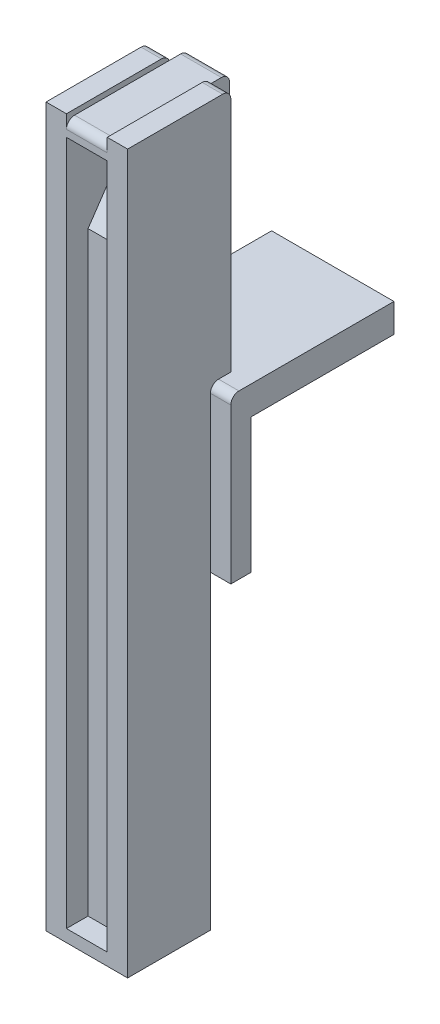
from build123d import *

# Parameters (mm, degrees)
BOSS_EXTRUDE2_DEPTH = 15
BOSS_EXTRUDE3_DEPTH = 5
BOSS_EXTRUDE4_DEPTH = 5
BOSS_EXTRUDE5_DEPTH = 10
SKETCH10_W          = 10
SKETCH10_H          = 3
BOSS_EXTRUDE6_DEPTH = 5.3
FILLET1_R           = 2
FILLET2_R           = 2


with BuildPart() as part:
    # Sketch2 → Boss-Extrude2 (new, symmetric)
    with BuildSketch(Plane(origin=(0, 0, 0), x_dir=(0, 0, -1), z_dir=(1, 0, 0))):
        Polygon((0, 0), (0, -40), (5, -40), (5, -7), (40, -7), (40, 0), align=None)
    extrude(amount=BOSS_EXTRUDE2_DEPTH, both=True)

    # Sketch3 → Boss-Extrude3 (add, symmetric)
    with BuildSketch(Plane(origin=(0, 0, 0), x_dir=(0, 0, -1), z_dir=(1, 0, 0))):
        Polygon((0, -116), (-15, -116), (-15, 32.97157442), (0, 55.00157442), align=None)
    extrude(amount=BOSS_EXTRUDE3_DEPTH, both=True)

    # Sketch4 → Boss-Extrude4 (add)
    with BuildSketch(Plane.ZY.offset(5)):
        Polygon((0, 60), (20.3, 60), (20.3, -116), (0, -116), (0, 0), (-5, 0), (-5, 60), align=None)
    boss_extrude4 = extrude(amount=BOSS_EXTRUDE4_DEPTH)

    # Mirror1: Boss-Extrude4 across plane
    add(boss_extrude4.mirror(Plane(origin=(0, 0, 0), x_dir=(0, 0, 1), z_dir=(1, 0, 0))))

    # Sketch8 → Boss-Extrude5 (add)
    with BuildSketch(Plane.ZY.offset(-5)):
        Polygon((0, 0), (0, 55), (20.3, 55), (20.3, 58.7), (-9.7, 58.7), (-9.7, 0), align=None)
    extrude(amount=BOSS_EXTRUDE5_DEPTH)

    # Sketch10 → Boss-Extrude6 (add)
    with BuildSketch(Plane.XY.offset(15)):
        with Locations((0, -114.5)):
            Rectangle(SKETCH10_W, SKETCH10_H)
    extrude(amount=BOSS_EXTRUDE6_DEPTH)

    # Fillet1
    # the kernel refuses this fillet: 2 mm, written as the material it takes off along each edge
    with BuildSketch(Plane(origin=(5, 58.7, 20.3), x_dir=(0, -1, 0), z_dir=(-1, 0, 0))) as fillet1_piece_1:
        with BuildLine():
            CenterArc((FILLET1_R, -FILLET1_R), FILLET1_R, 90, 90)
            Line((0, -FILLET1_R), (0, 0))
            Line((0, 0), (FILLET1_R, 0))
        make_face()
    extrude(amount=10, mode=Mode.SUBTRACT)
    with BuildSketch(Plane(origin=(10, 58.7, -9.7), x_dir=(0, 0, 1), z_dir=(-1, 0, 0))) as fillet1_piece_2:
        with BuildLine():
            CenterArc((FILLET1_R, -FILLET1_R), FILLET1_R, 90, 90)
            Line((0, -FILLET1_R), (0, 0))
            Line((0, 0), (FILLET1_R, 0))
        make_face()
    extrude(amount=20, mode=Mode.SUBTRACT)
    with BuildSketch(Plane(origin=(-5, 60, -5), x_dir=(0, -1, 0), z_dir=(-1, 0, 0)), Plane(origin=(5, 60, -5), x_dir=(0, 0, 1), z_dir=(1, 0, 0))) as fillet1_piece_3:
        with BuildLine():
            CenterArc((FILLET1_R, FILLET1_R), FILLET1_R, 180, 90)
            Line((0, FILLET1_R), (0, 0))
            Line((0, 0), (FILLET1_R, 0))
        make_face()
    extrude(amount=10, mode=Mode.SUBTRACT)

    # Fillet2
    fillet2_edges = [part.edges().sort_by_distance(p)[0] for p in [
        (12.5, 0, 0),
        (-12.5, 0, 0),
    ]]
    fillet(fillet2_edges, radius=FILLET2_R)


solid = part.part
